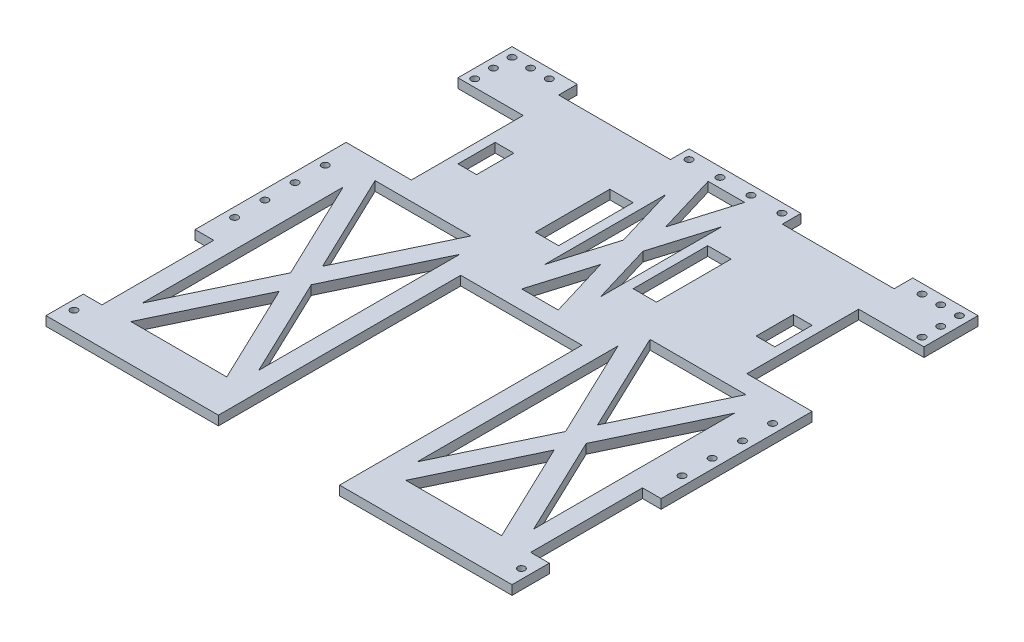
from build123d import *

# Parameters (mm, degrees)
BOSS_EXTRUDE1_DEPTH = 6.35
SKETCH2_W           = 44.45
SKETCH2_H           = 76.2
SKETCH2_W_2         = 12.7
SKETCH2_W_3         = 76.2
SKETCH2_H_2         = 12.7
CUT_EXTRUDE1_DEPTH  = 289.907554418
CUT_EXTRUDE3_DEPTH  = 289.907554418
SKETCH3_W           = 15.875
SKETCH3_H           = 50.8
SKETCH3_W_2         = 12.7
SKETCH3_H_2         = 25.4
CUT_EXTRUDE2_DEPTH  = 289.907554418
CUT_EXTRUDE5_DEPTH  = 289.907554418
SKETCH7_R           = 2.413
CUT_EXTRUDE6_DEPTH  = 289.907554418


with BuildPart() as part:
    # Sketch1 → Boss-Extrude1 (new body)
    with BuildSketch(Plane(origin=(0, 0, 0), x_dir=(1, 0, 0), z_dir=(0, 1, 0))):
        Polygon((-158.75, 76.2), (-158.75, -241.3), (-41.275, -241.3), (-41.275, -76.2), (41.275, -76.2), (41.275, -241.3), (158.75, -241.3), (158.75, 76.2), align=None)
    extrude(amount=BOSS_EXTRUDE1_DEPTH)

    # Sketch2 → Cut-Extrude1 (cut, through all)
    with BuildSketch(Plane(origin=(0, 6.35, 0), x_dir=(1, 0, 0), z_dir=(0, 1, 0))):
        with Locations((136.525, 1.27)):
            Rectangle(SKETCH2_W, SKETCH2_H)
        with Locations((152.4, -177.8)):
            Rectangle(SKETCH2_W_2, SKETCH2_H)
        with Locations((-152.4, -177.8)):
            Rectangle(SKETCH2_W_2, SKETCH2_H)
        with Locations((-136.525, 1.27)):
            Rectangle(SKETCH2_W, SKETCH2_H)
        with Locations((-76.2, 69.85)):
            Rectangle(SKETCH2_W_3, SKETCH2_H_2)
        with Locations((76.2, 69.85)):
            Rectangle(SKETCH2_W_3, SKETCH2_H_2)
    extrude(amount=-CUT_EXTRUDE1_DEPTH, mode=Mode.SUBTRACT)

    # Sketch4 → Cut-Extrude3 (cut, through all)
    with BuildSketch(Plane(origin=(0, 6.35, 0), x_dir=(1, 0, 0), z_dir=(0, 1, 0))):
        Polygon((93.6625, -147.46179464), (61.010684466, -215.9), (126.314315534, -215.9), align=None)
        Polygon((53.975, -64.27679464), (53.975, -201.15320536), (86.626815534, -132.715), align=None)
        Polygon((133.35, -64.27679464), (100.698184466, -132.715), (133.35, -201.15320536), align=None)
        Polygon((61.010684466, -49.53), (93.6625, -117.96820536), (126.314315534, -49.53), align=None)
        Polygon((-86.626815534, -132.715), (-53.975, -201.15320536), (-53.975, -64.27679464), align=None)
        Polygon((-126.314315534, -49.53), (-93.6625, -117.96820536), (-61.010684466, -49.53), align=None)
        Polygon((-61.010684466, -215.9), (-93.6625, -147.46179464), (-126.314315534, -215.9), align=None)
        Polygon((-133.35, -201.15320536), (-100.698184466, -132.715), (-133.35, -64.27679464), align=None)
    extrude(amount=-CUT_EXTRUDE3_DEPTH, mode=Mode.SUBTRACT)

    # Sketch3 → Cut-Extrude2 (cut, through all)
    with BuildSketch(Plane(origin=(0, 6.35, 0), x_dir=(1, 0, 0), z_dir=(0, 1, 0))):
        with Locations((-33.3375, 0)):
            Rectangle(SKETCH3_W, SKETCH3_H)
        with Locations((33.3375, 0)):
            Rectangle(SKETCH3_W, SKETCH3_H)
        with Locations((101.6, 1.27)):
            Rectangle(SKETCH3_W_2, SKETCH3_H_2)
        with Locations((-101.6, 1.27)):
            Rectangle(SKETCH3_W_2, SKETCH3_H_2)
    extrude(amount=-CUT_EXTRUDE2_DEPTH, mode=Mode.SUBTRACT)

    # Sketch6 → Cut-Extrude5 (cut, through all)
    with BuildSketch(Plane(origin=(0, 6.35, 0), x_dir=(1, 0, 0), z_dir=(0, 1, 0))):
        Polygon((12.420405367, 63.5), (-12.420405367, 63.5), (0, 22.098648777), align=None)
        Polygon((-6.629594633, 0), (-19.05, 41.401351223), (-19.05, -41.401351223), align=None)
        Polygon((19.05, 41.401351223), (6.629594633, 0), (19.05, -41.401351223), align=None)
        Polygon((12.420405367, -63.5), (0, -22.098648777), (-12.420405367, -63.5), align=None)
    extrude(amount=-CUT_EXTRUDE5_DEPTH, mode=Mode.SUBTRACT)

    # Sketch7 → Cut-Extrude6 (cut, through all)
    with BuildSketch(Plane(origin=(0, 6.35, 0), x_dir=(1, 0, 0), z_dir=(0, 1, 0))):
        with Locations((152.4, -119.126)):
            Circle(SKETCH7_R)
        with Locations((152.4, -98.552)):
            Circle(SKETCH7_R)
        with Locations((152.4, -77.978)):
            Circle(SKETCH7_R)
        with Locations((152.4, -57.404)):
            Circle(SKETCH7_R)
        with Locations((-152.4, -57.404)):
            Circle(SKETCH7_R)
        with Locations((-152.4, -77.978)):
            Circle(SKETCH7_R)
        with Locations((-152.4, -98.552)):
            Circle(SKETCH7_R)
        with Locations((-152.4, -119.126)):
            Circle(SKETCH7_R)
        with Locations((152.4, -228.6)):
            Circle(SKETCH7_R)
        with Locations((152.4, 69.85)):
            Circle(SKETCH7_R)
        with Locations((139.7, 69.85)):
            Circle(SKETCH7_R)
        with Locations((127, 69.85)):
            Circle(SKETCH7_R)
        with Locations((152.4, 57.15)):
            Circle(SKETCH7_R)
        with Locations((152.4, 44.45)):
            Circle(SKETCH7_R)
        with Locations((-152.4, 44.45)):
            Circle(SKETCH7_R)
        with Locations((-152.4, 57.15)):
            Circle(SKETCH7_R)
        with Locations((-127, 69.85)):
            Circle(SKETCH7_R)
        with Locations((-139.7, 69.85)):
            Circle(SKETCH7_R)
        with Locations((-152.4, 69.85)):
            Circle(SKETCH7_R)
        with Locations((-152.4, -228.6)):
            Circle(SKETCH7_R)
        with Locations((-31.75, 69.85)):
            Circle(SKETCH7_R)
        with Locations((-10.668, 69.85)):
            Circle(SKETCH7_R)
        with Locations((10.414, 69.85)):
            Circle(SKETCH7_R)
        with Locations((31.496, 69.85)):
            Circle(SKETCH7_R)
    extrude(amount=-CUT_EXTRUDE6_DEPTH, mode=Mode.SUBTRACT)


solid = part.part
